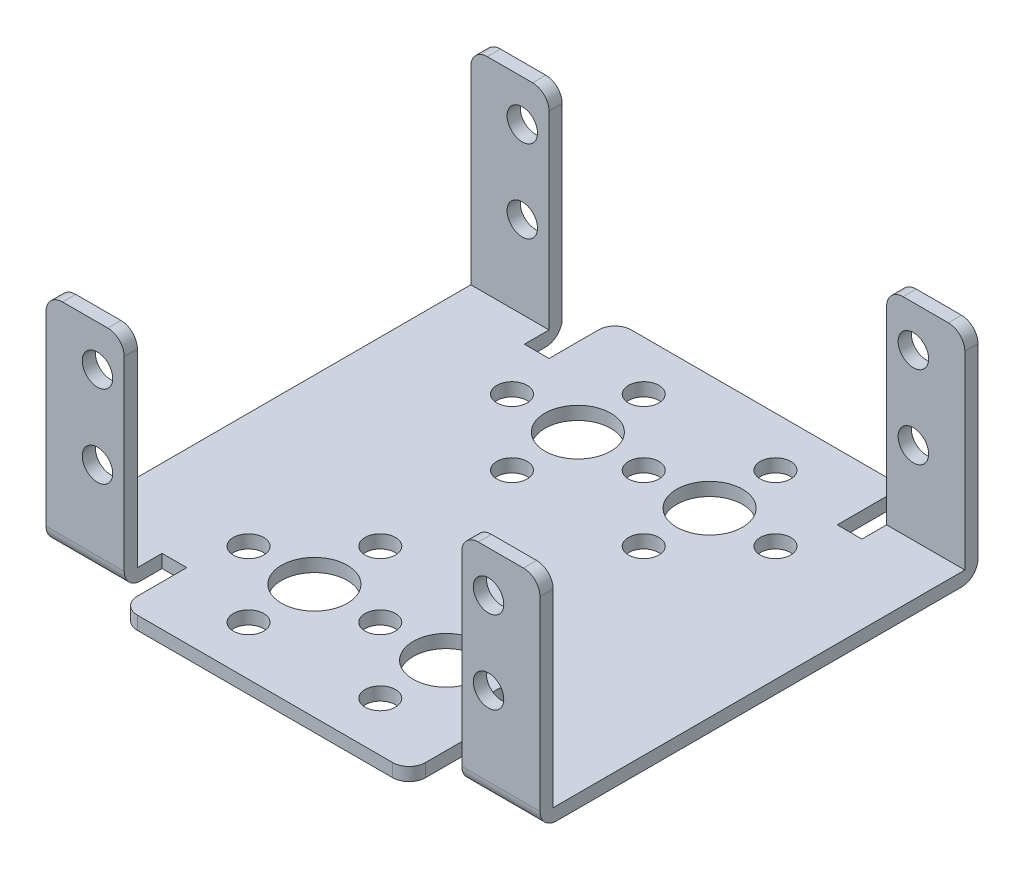
from build123d import *

# Parameters (mm, degrees)
EXTRUDE1_DEPTH           = 1.6
SKETCH4_W                = 9.5
SKETCH4_H                = 1.6
EXTRUDE2_DEPTH           = 25
SKETCH5_R                = 1.85
CUT_EXTRUDE1_DEPTH       = 87.666717949
CUT_EXTRUDE2_START       = -1.6
CUT_EXTRUDE2_OUTLINE_R   = 1.85
CUT_EXTRUDE2_OUTLINE_R_2 = 4
CUT_EXTRUDE2_DEPTH       = 1.6
FILLET1_R                = 2
FILLET2_R                = 2
FILLET3_R                = 2
FILLET4_R                = 2
FILLET5_R                = 2
FILLET6_R                = 2
FILLET7_R                = 2
FILLET8_R                = 2


# Read off the part's stored shape, not the designer's step: Cut-Extrude2
with BuildPart() as part:
    # Sketch1 → Extrude1 (new body)
    with BuildSketch(Plane(origin=(0, 0, 0), x_dir=(1, 0, 0), z_dir=(0, 1, 0))):
        Polygon((0, 0), (0, 53.2), (9.5, 53.2), (9.5, 48.6), (12.5, 48.6), (12.5, 56.6), (47.5, 56.6), (47.5, 48.6), (50.5, 48.6), (50.5, 53.2), (60, 53.2), (60, 0), (50.5, 0), (50.5, 4.6), (47.5, 4.6), (47.5, -3.4), (12.5, -3.4), (12.5, 4.6), (9.5, 4.6), (9.5, 0), align=None)
    extrude(amount=EXTRUDE1_DEPTH)

    # Sketch4 → Extrude2 (add)
    with BuildSketch(Plane(origin=(0, 1.6, 0), x_dir=(1, 0, 0), z_dir=(0, 1, 0))):
        with Locations((4.75, 52.4)):
            Rectangle(SKETCH4_W, SKETCH4_H)
        with Locations((55.25, 52.4)):
            Rectangle(SKETCH4_W, SKETCH4_H)
        with Locations((55.25, 0.8)):
            Rectangle(SKETCH4_W, SKETCH4_H)
        with Locations((4.75, 0.8)):
            Rectangle(SKETCH4_W, SKETCH4_H)
    extrude(amount=EXTRUDE2_DEPTH)

    # Sketch5 → Cut-Extrude1 (cut, through all)
    with BuildSketch(Plane.XY):
        with Locations((6.25, 21.6)):
            Circle(SKETCH5_R)
        with Locations((6.25, 11.6)):
            Circle(SKETCH5_R)
        with Locations((53.75, 21.6)):
            Circle(SKETCH5_R)
        with Locations((53.75, 11.6)):
            Circle(SKETCH5_R)
    extrude(amount=-CUT_EXTRUDE1_DEPTH, mode=Mode.SUBTRACT)

    # Cut-Extrude2 outline → Cut-Extrude2 (cut)
    with BuildSketch(Plane(origin=(0, 1.6, 0), x_dir=(1, 0, 0), z_dir=(0, 1, 0)).offset(CUT_EXTRUDE2_START)):
        with Locations((14, 10.6)):
            Circle(CUT_EXTRUDE2_OUTLINE_R)
        with Locations((14, 42.6)):
            Circle(CUT_EXTRUDE2_OUTLINE_R)
        with Locations((22, 42.6)):
            Circle(CUT_EXTRUDE2_OUTLINE_R_2)
        with Locations((30, 42.6)):
            Circle(CUT_EXTRUDE2_OUTLINE_R)
        with Locations((22, 34.6)):
            Circle(CUT_EXTRUDE2_OUTLINE_R)
        with Locations((22, 50.6)):
            Circle(CUT_EXTRUDE2_OUTLINE_R)
        with Locations((22, 10.6)):
            Circle(CUT_EXTRUDE2_OUTLINE_R_2)
        with Locations((30, 10.6)):
            Circle(CUT_EXTRUDE2_OUTLINE_R)
        with Locations((22, 2.6)):
            Circle(CUT_EXTRUDE2_OUTLINE_R)
        with Locations((22, 18.6)):
            Circle(CUT_EXTRUDE2_OUTLINE_R)
        with Locations((38, 10.6)):
            Circle(CUT_EXTRUDE2_OUTLINE_R_2)
        with Locations((46, 10.6)):
            Circle(CUT_EXTRUDE2_OUTLINE_R)
        with Locations((38, 2.6)):
            Circle(CUT_EXTRUDE2_OUTLINE_R)
        with Locations((38, 18.6)):
            Circle(CUT_EXTRUDE2_OUTLINE_R)
        with Locations((38, 42.6)):
            Circle(CUT_EXTRUDE2_OUTLINE_R_2)
        with Locations((46, 42.6)):
            Circle(CUT_EXTRUDE2_OUTLINE_R)
        with Locations((38, 34.6)):
            Circle(CUT_EXTRUDE2_OUTLINE_R)
        with Locations((38, 50.6)):
            Circle(CUT_EXTRUDE2_OUTLINE_R)
    extrude(amount=CUT_EXTRUDE2_DEPTH, mode=Mode.SUBTRACT)

    # Fillet1
    fillet1_edges = [part.edges().sort_by_distance(p)[0] for p in [
        (60, 26.6, -0.8),
    ]]
    fillet(fillet1_edges, radius=FILLET1_R)

    # Fillet2
    fillet2_edges = [part.edges().sort_by_distance(p)[0] for p in [
        (60, 26.6, -52.4),
        (9.5, 26.6, -52.4),
        (9.5, 26.6, -0.8),
    ]]
    fillet(fillet2_edges, radius=FILLET2_R)

    # Fillet3
    fillet3_edges = [part.edges().sort_by_distance(p)[0] for p in [
        (47.5, 0.8, 3.4),
    ]]
    fillet(fillet3_edges, radius=FILLET3_R)

    # Fillet4
    fillet4_edges = [part.edges().sort_by_distance(p)[0] for p in [
        (12.5, 0.8, 3.4),
        (50.5, 26.6, -0.8),
        (0, 26.6, -0.8),
        (0, 26.6, -52.4),
        (50.5, 26.6, -52.4),
    ]]
    fillet(fillet4_edges, radius=FILLET4_R)

    # Fillet5
    fillet5_edges = [part.edges().sort_by_distance(p)[0] for p in [
        (12.5, 0.8, -56.6),
    ]]
    fillet(fillet5_edges, radius=FILLET5_R)

    # Fillet6
    fillet6_edges = [part.edges().sort_by_distance(p)[0] for p in [
        (47.5, 0.8, -56.6),
    ]]
    fillet(fillet6_edges, radius=FILLET6_R)

    # Fillet7
    fillet7_edges = [part.edges().sort_by_distance(p)[0] for p in [
        (55.25, 0, 0),
        (4.75, 0, 0),
    ]]
    fillet(fillet7_edges, radius=FILLET7_R)

    # Fillet8
    fillet8_edges = [part.edges().sort_by_distance(p)[0] for p in [
        (4.75, 0, -53.2),
        (55.25, 0, -53.2),
    ]]
    fillet(fillet8_edges, radius=FILLET8_R)


solid = part.part
